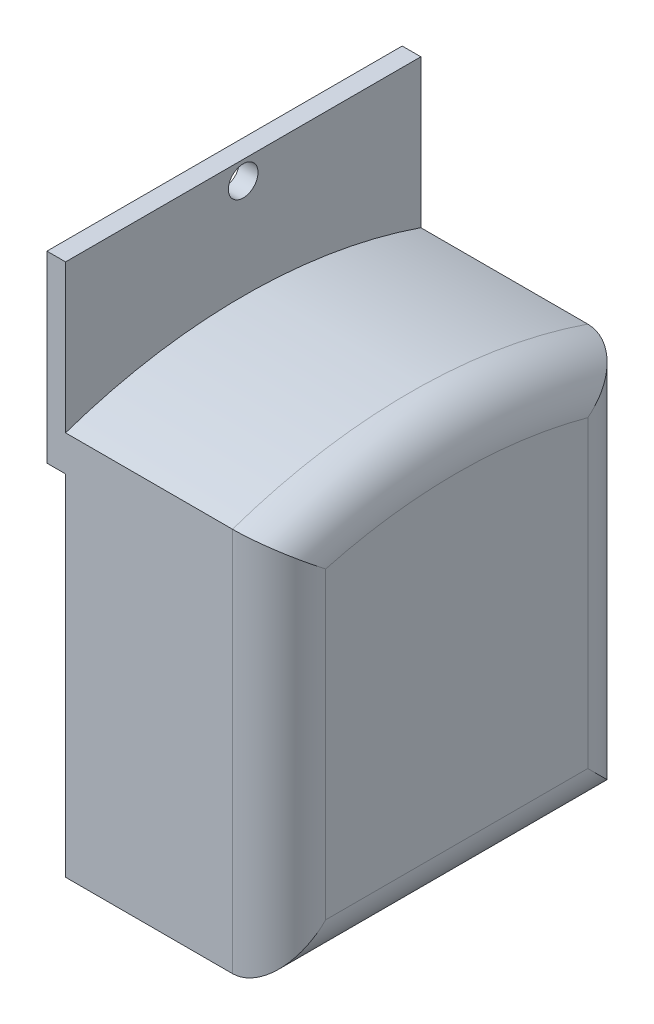
from build123d import *

# Parameters (mm, degrees)
BOSS_EXTRUDE1_DEPTH = 76.2
CUT_EXTRUDE1_DEPTH  = 76.2
CUT_EXTRUDE3_DEPTH  = 45.8
SKETCH4_W           = 45.8
SKETCH4_H           = 25.4
BOSS_EXTRUDE2_DEPTH = 76.2
FILLET3_R           = 10


with BuildPart() as part:
    # Sketch1 → Boss-Extrude1 (new body)
    with BuildSketch(Plane.XY):
        Polygon((0, 0), (0, 49.513226603), (-4, 49.513226603), (-4, 88.9), (0, 88.9), (0, 76.2), (45.8, 76.2), (45.8, 0), align=None)
    extrude(amount=BOSS_EXTRUDE1_DEPTH)

    # Sketch2 → Cut-Extrude1 (cut)
    with BuildSketch(Plane(origin=(0, 0, 0), x_dir=(0, 0, -1), z_dir=(1, 0, 0))):
        with BuildLine():
            ThreePointArc((-38.1, 88.075), (-40.34506403, 82.65493597), (-34.925, 84.9))
            ThreePointArc((-34.925, 84.9), (-35.85493597, 87.14506403), (-38.1, 88.075))
        make_face()
    extrude(amount=-CUT_EXTRUDE1_DEPTH, mode=Mode.SUBTRACT)

    # Sketch3 → Cut-Extrude3 (cut)
    with BuildSketch(Plane(origin=(45.8, 0, 0), x_dir=(0, 0, -1), z_dir=(1, 0, 0))):
        with BuildLine():
            Line((0, 76.2), (-76.2, 76.2))
            Line((-76.2, 76.2), (-76.2, 57.15))
            ThreePointArc((-76.2, 57.15), (-38.1, 63.521668036), (0, 57.15))
            Line((0, 57.15), (0, 76.2))
        make_face()
    extrude(amount=-CUT_EXTRUDE3_DEPTH, mode=Mode.SUBTRACT)

    # Sketch4 → Boss-Extrude2 (add)
    with BuildSketch(Plane.XY.offset(76.2)):
        with Locations((22.9, -12.7)):
            Rectangle(SKETCH4_W, SKETCH4_H)
    extrude(amount=-BOSS_EXTRUDE2_DEPTH)

    # Fillet3
    fillet3_edges = [part.edges().sort_by_distance(p)[0] for p in [
        (45.8, -25.4, 38.1),
        (45.8, 15.875, 76.2),
        (45.8, 63.521668036, 38.1),
        (45.8, 15.875, 0),
    ]]
    fillet(fillet3_edges, radius=FILLET3_R)


solid = part.part
